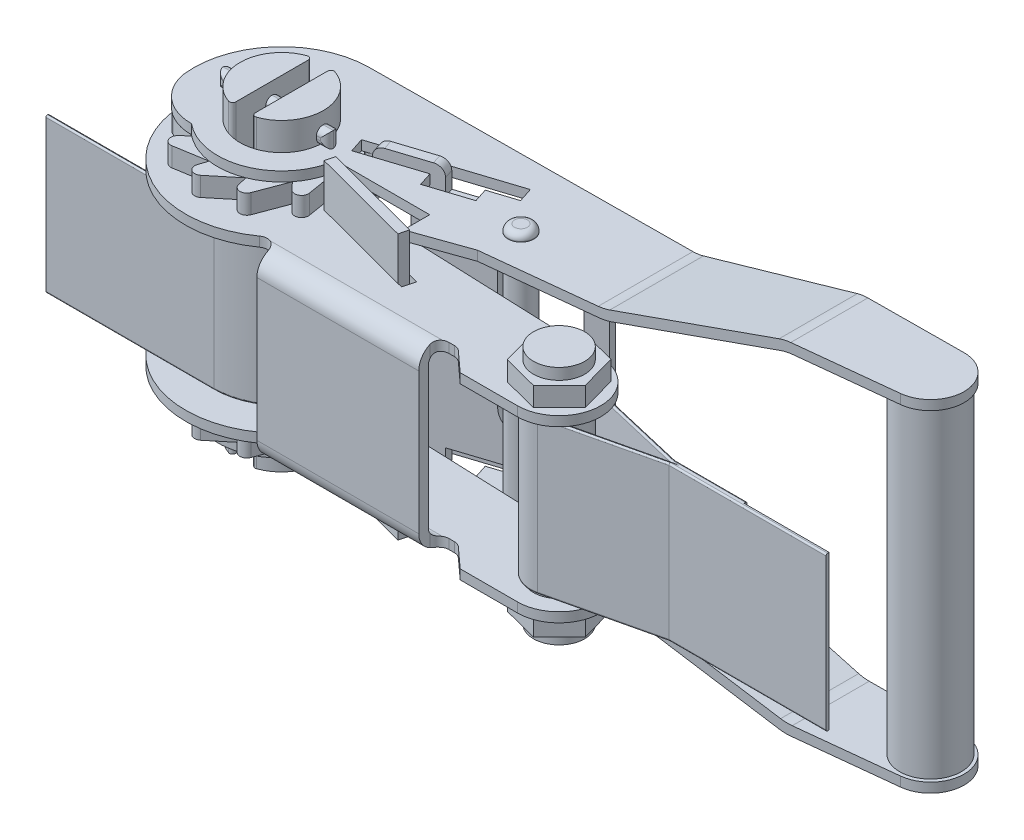
from build123d import *

# Parameters (mm, degrees)
SKETCH6_R                = 9.61135184745859
BOSS_EXTRUDE1_DEPTH      = 49.99999999999999
BOSS_EXTRUDE2_DEPTH      = 34.99999999999999
CUT_EXTRUDE2_START       = 35.801780174
CUT_EXTRUDE2_OUTLINE_W   = 224.768763946
CUT_EXTRUDE2_OUTLINE_H   = 70
CUT_EXTRUDE2_OUTLINE_R   = 3.996033937
CUT_EXTRUDE2_OUTLINE_R_2 = 13
CUT_EXTRUDE2_DEPTH       = 17.3864652
SKETCH9_W                = 147.82614241764912
SKETCH9_H                = 3
BOSS_EXTRUDE3_DEPTH      = 34.99999999999999
SKETCH10_R               = 13.000000000000002
CUT_EXTRUDE3_DEPTH       = 69.99999999999999
FILLET3_R                = 12
FILLET1_R                = 3
FILLET2_R                = 1
SKETCH11_R               = 13.000000000000002
BOSS_EXTRUDE4_DEPTH      = 6
SKETCH12_R               = 7.999999999999998
BOSS_EXTRUDE5_DEPTH      = 37.5
BOSS_EXTRUDE6_DEPTH      = 6
BOSS_EXTRUDE7_DEPTH      = 47.5
BOSS_EXTRUDE7_2_DEPTH    = 47.5
FILLET4_R                = 1
FILLET5_R                = 1
BOSS_EXTRUDE8_REACH      = 167.685
SKETCH15_W               = 50.51678297357947
SKETCH15_H               = 3
FILLET6_R                = 3
FILLET7_R                = 6
BOSS_EXTRUDE9_DEPTH      = 3
FILLET8_R                = 6
FILLET9_R                = 3
SKETCH17_R               = 4.234641109572187
BOSS_EXTRUDE10_DEPTH     = 3
SKETCH18_W               = 34.37557361080151
SKETCH18_H               = 4.853710087710901
BOSS_EXTRUDE11_DEPTH     = 2
BOSS_EXTRUDE11_2_DEPTH   = 2
FILLET10_R               = 2
FILLET11_R               = 2
SKETCH19_R               = 3.9960339372358598
BOSS_EXTRUDE12_DEPTH     = 41
FILLET12_R               = 2
SKETCH21_R               = 13.000000000000002
BOSS_EXTRUDE13_DEPTH     = 24
BOSS_EXTRUDE13_2_DEPTH   = 24
FILLET14_R               = 0.5
FILLET15_R               = 0.5


# Read off the part's stored shape, not the designer's step: Cut-Extrude2
with BuildPart() as part:
    # Sketch6 → Boss-Extrude1 (new, symmetric)
    with BuildSketch(Plane(origin=(0, 0, 0), x_dir=(1, 0, 0), z_dir=(0, 1, 0))):
        with Locations(Location((132.09279218975152, 21.208873885123804, 0), (0, 0, 90))):
            Circle(SKETCH6_R)
    extrude(amount=BOSS_EXTRUDE1_DEPTH, both=True)


with BuildPart() as body_2:
    # Sketch7 → Boss-Extrude2 (new, symmetric)
    with BuildSketch(Plane.XY):
        Polygon((143.76876394629363, 50.188245373729615), (101.02636733752342, 50.188245373729615), (50.15249039830427, 35.80178017370452), (-81.00000000000001, 35.80178017370453), (-81.00000000000001, 38.80178017370452), (49.73646730393172, 38.80178017370452), (100.61034424315088, 53.18824537372962), (143.76876394629363, 53.18824537372962), align=None)
    extrude(amount=BOSS_EXTRUDE2_DEPTH, both=True)

    # Cut-Extrude2 outline → Cut-Extrude2 (cut)
    # profile 1 of 4: a face of its own
    with BuildSketch(Plane(origin=(0, 0, 0), x_dir=(1, 0, 0), z_dir=(0, 1, 0)).offset(CUT_EXTRUDE2_START)):
        with Locations((31.384381973000004, 0)):
            Rectangle(CUT_EXTRUDE2_OUTLINE_W, CUT_EXTRUDE2_OUTLINE_H)
        with BuildLine():
            ThreePointArc((-64.763616752, -12.535987568), (-74.249472979, -9.196039153), (-79.304490688, -0.502160862))
            ThreePointArc((-79.304490688, -0.502160862), (-72.682079099, 21.010495289), (-52.211895915, 30.371174236))
            Line((-52.211895915, 30.371174236), (132.016568511, 31.708597212))
            ThreePointArc((132.016568511, 31.708597212), (142.575396332, 21.813034785), (133.223361355, 10.769917359))
            Line((133.223361355, 10.769917359), (14.061394225, -2.13566812))
            Line((14.061394225, -2.13566812), (-2.964752104, -8.175195839))
            Line((-2.964752104, -8.175195839), (-2.964752104, 0))
            Line((-2.964752104, 0), (-32.219531559, 0))
            ThreePointArc((-32.219531559, 0), (-44.823174053, -15.791354016), (-64.763616752, -12.535987568))
        make_face(mode=Mode.SUBTRACT)
    # profile 2 of 4: a face of its own
    with BuildSketch(Plane(origin=(0, 0, 0), x_dir=(1, 0, 0), z_dir=(0, 1, 0)).offset(CUT_EXTRUDE2_START)):
        with Locations((15.881169485, 9.634125828)):
            Circle(CUT_EXTRUDE2_OUTLINE_R)
    # profile 3 of 4: a face of its own
    with BuildSketch(Plane(origin=(0, 0, 0), x_dir=(1, 0, 0), z_dir=(0, 1, 0)).offset(CUT_EXTRUDE2_START)):
        Polygon((7.40122384, 17.995674749), (5.943232843, 22.505928047), (-18.509037252, 14.60145189), (-19.1190468, 16.488498916), (-24.25388904, 14.828602396), (-23.643879492, 12.941555369), (-33.875317839, 9.634125828), (-32.417326842, 5.12387253), (-13.966042498, 11.088461363), (-12.57730845, 6.79245245), (0.449412623, 11.003489123), (-0.939321424, 15.299498037), align=None)
    # profile 4 of 4: a face of its own
    with BuildSketch(Plane(origin=(0, 0, 0), x_dir=(1, 0, 0), z_dir=(0, 1, 0)).offset(CUT_EXTRUDE2_START)):
        with Locations((-52.012262471, 2.871898855)):
            Circle(CUT_EXTRUDE2_OUTLINE_R_2)
    extrude(amount=CUT_EXTRUDE2_DEPTH, mode=Mode.SUBTRACT)

    # Fillet3
    fillet3_edges = [body_2.edges().sort_by_distance(p)[0] for p in [
        (101.02636733752342, 50.188245373729615, -19.383255461272107),
        (50.15249039830427, 35.80178017370452, -16.443699774766543),
        (49.73646730393172, 38.80178017370452, -16.419661444559445),
        (100.61034424315088, 53.18824537372962, -19.35921713106501),
    ]]
    fillet(fillet3_edges, radius=FILLET3_R)

    # Sketch11 → Boss-Extrude4 (add)
    with BuildSketch(Plane.XZ.offset(-35.80178017370452)):
        with BuildLine():
            Line((-66.59428790947788, 14.864612404070485), (-64.37990306780027, 12.844963745801456))
            Line((-64.37990306780027, 12.844963745801456), (-73.80426310057402, 9.303634331822696))
            ThreePointArc((-73.80426310057402, 9.303634331822696), (-75.19028777978409, 7.1401863065424775), (-73.5089225687676, 5.1973577508918))
            Line((-73.5089225687676, 5.1973577508918), (-70.58138471298513, 4.555483126950324))
            Line((-70.58138471298513, 4.555483126950324), (-76.97245520878865, -3.2235781251114166))
            ThreePointArc((-76.97245520878865, -3.2235781251114166), (-77.0910637786166, -5.790191414376377), (-74.6635445150116, -6.632047693259443))
            Line((-74.6635445150116, -6.632047693259443), (-71.80728504939263, -5.724158495745956))
            Line((-71.80728504939263, -5.724158495745956), (-73.45258383010481, -15.656558405528473))
            ThreePointArc((-73.45258383010481, -15.656558405528473), (-72.27199522004992, -17.938615000636666), (-69.74877373015035, -17.45392429268236))
            Line((-69.74877373015035, -17.45392429268236), (-67.72912507188127, -15.239539451004536))
            Line((-67.72912507188127, -15.239539451004536), (-64.18779565790233, -24.663899483778728))
            ThreePointArc((-64.18779565790233, -24.663899483778728), (-62.02434763262211, -26.049924162988795), (-60.081519076971425, -24.368558951972304))
            Line((-60.081519076971425, -24.368558951972304), (-59.439644453030084, -21.441021096189534))
            Line((-59.439644453030084, -21.441021096189534), (-51.660583200968226, -27.832091591993304))
            ThreePointArc((-51.660583200968226, -27.832091591993304), (-49.093969911703255, -27.950700161821285), (-48.252113632820176, -25.523180898216285))
            Line((-48.252113632820176, -25.523180898216285), (-49.16000283033389, -22.66692143259692))
            Line((-49.16000283033389, -22.66692143259692), (-39.227602920551135, -24.312220213309445))
            ThreePointArc((-39.227602920551135, -24.312220213309445), (-36.94554632544294, -23.131631603254526), (-37.43023703339726, -20.608410113354964))
            Line((-37.43023703339726, -20.608410113354964), (-39.6446218750753, -18.588761455085557))
            Line((-39.6446218750753, -18.588761455085557), (-30.220261842300935, -15.04743204110692))
            ThreePointArc((-30.220261842300935, -15.04743204110692), (-28.834237163090872, -12.883984015826698), (-30.515602374107374, -10.94115546017602))
            Line((-30.515602374107374, -10.94115546017602), (-33.44314022989038, -10.29928083623445))
            Line((-33.44314022989038, -10.29928083623445), (-27.05206973408641, -2.5202195841728185))
            ThreePointArc((-27.05206973408641, -2.5202195841728185), (-26.933461164258436, 0.04639370509216212), (-29.36098042786345, 0.8882499839752214))
            Line((-29.36098042786345, 0.8882499839752214), (-32.21723989348291, -0.01963921353818541))
            Line((-32.21723989348291, -0.01963921353818541), (-30.57194111277031, 9.912760696244248))
            ThreePointArc((-30.57194111277031, 9.912760696244248), (-31.75252972282524, 12.194817291352448), (-34.275751212724806, 11.71012658339811))
            Line((-34.275751212724806, 11.71012658339811), (-36.295399870994274, 9.495741741720401))
            Line((-36.295399870994274, 9.495741741720401), (-39.83672928497287, 18.920101774494434))
            ThreePointArc((-39.83672928497287, 18.920101774494434), (-42.00017731025309, 20.306126453704486), (-43.94300586590377, 18.624761242687985))
            Line((-43.94300586590377, 18.624761242687985), (-44.584880489845375, 15.697223386905316))
            Line((-44.584880489845375, 15.697223386905316), (-52.36394174190699, 22.08829388270892))
            ThreePointArc((-52.36394174190699, 22.08829388270892), (-54.930555031171956, 22.20690245253688), (-55.772411310055034, 19.77938318893188))
            Line((-55.772411310055034, 19.77938318893188), (-54.86452211254154, 16.923123723312774))
            Line((-54.86452211254154, 16.923123723312774), (-64.79692202232404, 18.56842250402498))
            ThreePointArc((-64.79692202232404, 18.56842250402498), (-67.07897861743223, 17.387833893970043), (-66.59428790947788, 14.864612404070485))
        make_face()
        with Locations(Location((-52.01226247143909, -2.8718988546432773, 0), (0, 0, 90))):
            Circle(SKETCH11_R, mode=Mode.SUBTRACT)
    extrude(amount=BOSS_EXTRUDE4_DEPTH)


with BuildPart() as body_3:
    # Sketch9 → Boss-Extrude3 (new, symmetric)
    with BuildSketch(Plane.XY):
        with Locations((-9.374115610495167, -26.500000000000004)):
            Rectangle(SKETCH9_W, SKETCH9_H)
    extrude(amount=BOSS_EXTRUDE3_DEPTH, both=True)

    # Sketch10 → Cut-Extrude3 (cut)
    # profile 1 of 3: a face of its own
    with BuildSketch(Plane(origin=(0, 0, 0), x_dir=(1, 0, 0), z_dir=(0, 1, 0))):
        Polygon((73.92143290269355, 40.40180807210002), (-93.71216160194659, 40.40180807210002), (-93.71216160194659, -39.2449992671693), (73.92143290269355, -39.244999267169305), align=None)
        with BuildLine():
            ThreePointArc((51.53895559832939, -1.128101145356709), (64.5389555983294, -14.128101145356707), (51.538955598329395, -27.12810114535671))
            Line((51.538955598329395, -27.12810114535671), (33.6755600799571, -27.12810114535671))
            Line((33.6755600799571, -27.12810114535671), (26.592047389567554, -20.688544154093456))
            Line((26.592047389567554, -20.688544154093456), (20.754061511296502, -20.688544154093456))
            Line((20.754061511296502, -20.688544154093456), (20.754061511296502, -27.128101145356716))
            Line((20.754061511296502, -27.128101145356716), (-29.762721462282965, -27.12810114535672))
            Line((-29.76272146228297, -27.12810114535672), (-29.76272146228299, -17.25166755098872))
            ThreePointArc((-29.76272146228299, -17.25166755098872), (-62.69784673295965, -25.160551787245737), (-82.01154808516429, 2.6648658472755336))
            Line((-82.01154808516429, 2.6648658472755336), (-76.01136948261474, 2.6648658472755336))
            ThreePointArc((-76.01136948261474, 2.6648658472755375), (-51.65248535511648, 26.869202045347244), (-28.030148137420955, 1.9455122884182452))
            Line((-28.03014813742095, 1.9455122884182454), (51.538955598329395, -1.1281011453567105))
        make_face(mode=Mode.SUBTRACT)
    # profile 2 of 3: a face of its own
    with BuildSketch(Plane(origin=(0, 0, 0), x_dir=(1, 0, 0), z_dir=(0, 1, 0))):
        with Locations(Location((-52.01226247143909, 2.8718988546432773, 0), (0, 0, 270))):
            Circle(SKETCH10_R)
    # profile 3 of 3: a face of its own
    with BuildSketch(Plane(origin=(0, 0, 0), x_dir=(1, 0, 0), z_dir=(0, 1, 0))):
        Polygon((-29.762721462282986, -0.9197060989426281), (2.3462008682077995, -9.413724255451257), (1.3636084156105066, -13.128101145356707), (-30.745313914880278, -4.6340829888480775), align=None)
    extrude(amount=-CUT_EXTRUDE3_DEPTH, mode=Mode.SUBTRACT)

    # Fillet1
    fillet1_edges = [body_3.edges().sort_by_distance(p)[0] for p in [
        (-29.76272146228299, -26.5, 17.25166755098872),
        (20.754061511296502, -26.5, 20.688544154093456),
        (26.592047389567554, -26.5, 20.688544154093456),
    ]]
    fillet(fillet1_edges, radius=FILLET1_R)

    # Fillet2
    fillet2_edges = [body_3.edges().sort_by_distance(p)[0] for p in [
        (-76.01136948261474, -26.5, -2.6648658472755358),
        (-82.01154808516429, -26.5, -2.6648658472755313),
    ]]
    fillet(fillet2_edges, radius=FILLET2_R)


with BuildPart() as body_4:
    # Mirror1: mirrored copy
    add(body_2.part.mirror(Plane.ZX))


with BuildPart() as body_5:
    # Mirror1 2: mirrored copy
    add(body_3.part.mirror(Plane.ZX))


with BuildPart() as body_3_1:
    add(body_3.part)

    add(body_5.part)  # Boss-Extrude5 merges body 5
    # Sketch12 → Boss-Extrude5 (add, symmetric)
    with BuildSketch(Plane(origin=(0, 0, 0), x_dir=(1, 0, 0), z_dir=(0, 1, 0))):
        with Locations(Location((51.538955598329395, -14.12810114535671, 0), (0, 0, 90))):
            Circle(SKETCH12_R)
    extrude(amount=BOSS_EXTRUDE5_DEPTH, both=True)

    # Sketch13 → Boss-Extrude6 (add)
    with BuildSketch(Plane(origin=(0, 28, 0), x_dir=(1, 0, 0), z_dir=(0, 1, 0))):
        Polygon((48.48449443308388, -3.106680129414185), (40.46689443009672, -11.262631601361084), (43.52135559534224, -22.284052617303598), (54.5934167635749, -25.149522161299224), (62.61101676656207, -16.99357068935233), (59.55655560131656, -5.972149673409814), align=None)
    boss_extrude6 = extrude(amount=BOSS_EXTRUDE6_DEPTH)

    # Mirror2: Boss-Extrude6 across plane
    add(boss_extrude6.mirror(Plane.ZX))

    # Sketch15 → Boss-Extrude8 (add, up to next)
    with BuildSketch(Plane(origin=(0, -25, 0), x_dir=(1, 0, 0), z_dir=(0, 1, 0)), mode=Mode.PRIVATE) as boss_extrude8_sk1:
        with Locations((-4.504329975493233, -25.62810114535672)):
            Rectangle(SKETCH15_W, SKETCH15_H)
    boss_extrude8_tool1 = extrude(boss_extrude8_sk1.sketch, amount=BOSS_EXTRUDE8_REACH, mode=Mode.PRIVATE) - body_3_1.part
    add(boss_extrude8_tool1.solids().sort_by_distance((-4.50433, -25, 25.628101))[0])

    # Fillet6
    fillet6_edges = [body_3_1.edges().sort_by_distance(p)[0] for p in [
        (-4.504329975493228, 25, 24.12810114535672),
        (-4.504329975493231, -25, 24.12810114535672),
    ]]
    fillet(fillet6_edges, radius=FILLET6_R)

    # Fillet7
    fillet7_edges = [body_3_1.edges().sort_by_distance(p)[0] for p in [
        (-4.504329975493228, -28, 27.12810114535672),
        (-4.504329975493228, 28, 27.12810114535672),
    ]]
    fillet(fillet7_edges, radius=FILLET7_R)


with BuildPart() as body_5_2:
    # Sketch14 → Boss-Extrude7 (new, symmetric)
    with BuildSketch(Plane(origin=(0, 0, 0), x_dir=(1, 0, 0), z_dir=(0, 1, 0))):
        with BuildLine():
            Line((-49.01226247143909, -9.777211786030241), (-49.01226247143909, 15.521009495316797))
            ThreePointArc((-49.01226247143909, 15.521009495316797), (-39.01226247143909, 2.8718988546432773), (-49.01226247143909, -9.777211786030241))
        make_face()
    extrude(amount=BOSS_EXTRUDE7_DEPTH, both=True)

    # Fillet5
    fillet5_edges = [body_5_2.edges().sort_by_distance(p)[0] for p in [
        (-49.01226247143909, 0, 9.77721178603024),
        (-49.01226247143909, 0, -15.521009495316797),
    ]]
    fillet(fillet5_edges, radius=FILLET5_R)


with BuildPart() as body_6:
    # Sketch14 → Boss-Extrude7 2 (new, symmetric)
    with BuildSketch(Plane(origin=(0, 0, 0), x_dir=(1, 0, 0), z_dir=(0, 1, 0))):
        with BuildLine():
            Line((-55.01226247143908, -9.777211786030241), (-55.01226247143908, 15.521009495316797))
            ThreePointArc((-55.01226247143908, 15.521009495316797), (-65.01226247143909, 2.871898854643279), (-55.01226247143908, -9.777211786030241))
        make_face()
    extrude(amount=BOSS_EXTRUDE7_2_DEPTH, both=True)

    # Fillet4
    fillet4_edges = [body_6.edges().sort_by_distance(p)[0] for p in [
        (-55.01226247143908, 0, -15.521009495316797),
        (-55.01226247143909, 0, 9.777211786030241),
    ]]
    fillet(fillet4_edges, radius=FILLET4_R)


with BuildPart() as body_2_1:
    add(body_2.part)

    add(body_4.part)  # Boss-Extrude9 merges body 4
    # Sketch16 → Boss-Extrude9 (add)
    with BuildSketch(Plane(origin=(-4.566685668778086, 0, -14.12691103072603), x_dir=(-0.9515191663224783, 0, 0.3075894603541801), z_dir=(-0.3075894603541801, 0, -0.9515191663224783))):
        Polygon((-34.55706427424359, -34), (-34.557064274243615, 34), (6.008093453893082, 34.00000000000001), (6.008093453893082, 42.06447314697748), (24.126726852992906, 42.06447314697748), (24.126726852992906, 28.68561573451147), (14.600824968169945, 28.68561573451147), (14.600824968169938, -28.68561573451147), (24.126726852992892, -28.68561573451147), (24.126726852992892, -42.06447314697748), (6.008093453893078, -42.06447314697748), (6.008093453893078, -34.00000000000001), align=None)
        Polygon((-28.245714526718736, -25), (-28.24571452671875, 25), (-6.89948800561524, 25), (-6.899488005615236, -25), align=None, mode=Mode.SUBTRACT)
    extrude(amount=BOSS_EXTRUDE9_DEPTH)

    # Fillet8
    fillet8_edges = [body_2_1.edges().sort_by_distance(p)[0] for p in [
        (21.848268879336786, 25, -24.242273868801394),
        (21.84826887933677, -25, -24.24227386880139),
        (1.5369252158455926, -25, -17.676399572577076),
        (1.5369252158455953, 25, -17.67639957257708),
    ]]
    fillet(fillet8_edges, radius=FILLET8_R)

    # Fillet9
    fillet9_edges = [body_2_1.edges().sort_by_distance(p)[0] for p in [
        (-10.744885933745241, 42.06447314697748, -13.706163556969292),
        (27.853639129471233, 34, -26.183578531749056),
        (27.853639129471205, -34, -26.18357853174905),
        (-10.744885933745238, -42.06447314697748, -13.706163556969292),
        (-27.985112880559303, -42.06447314697748, -8.133062887384957),
        (-27.985112880559317, 42.06447314697748, -8.133062887384954),
    ]]
    fillet(fillet9_edges, radius=FILLET9_R)

    add(body_3_1.part)  # Boss-Extrude10 merges body 3
    # Sketch17 → Boss-Extrude10 (add)
    with BuildSketch(Plane(origin=(-3.1565549955040177, 0, 11.932347837624759), x_dir=(-0.9667454532933696, 0, -0.25574054926154643), z_dir=(0.25574054926154643, 0, -0.9667454532933696))):
        Polygon((-3.0935020470364996, 41.38228603912517), (29.31416953340523, 41.382286039125184), (29.314169533405234, 19.628750869488858), (33.13642588321386, 19.628750869488858), (33.13642588321386, -19.39856964860974), (29.314169533405238, -19.39856964860974), (29.31416953340524, -41.38228603912517), (-3.093502047036489, -41.38228603912517), align=None)
        with Locations(Location((22.602441811747376, 0, 0), (0, 0, 180))):
            Circle(SKETCH17_R, mode=Mode.SUBTRACT)
    extrude(amount=BOSS_EXTRUDE10_DEPTH)

    # Sketch19 → Boss-Extrude12 (add, symmetric)
    with BuildSketch(Plane(origin=(0, 0, 0), x_dir=(1, 0, 0), z_dir=(0, 1, 0))):
        with Locations(Location((15.88116948462022, 9.634125827732062, 0), (0, 0, 270))):
            Circle(SKETCH19_R)
    extrude(amount=BOSS_EXTRUDE12_DEPTH, both=True)

    # Fillet12
    fillet12_edges = [body_2_1.edges().sort_by_distance(p)[0] for p in [
        (15.881169484620221, -41, -13.630159764967921),
        (15.881169484620221, 41, -13.630159764967921),
    ]]
    fillet(fillet12_edges, radius=FILLET12_R)


with BuildPart() as body_5_3:
    # Sketch18 → Boss-Extrude11 (new, symmetric)
    with BuildSketch(Plane.XY.offset(-2.8718988546432773)):
        with Locations((-53.10567349259029, 41.22863521755997)):
            Rectangle(SKETCH18_W, SKETCH18_H)
    extrude(amount=BOSS_EXTRUDE11_DEPTH, both=True)

    # Fillet10
    fillet10_edges = [body_5_3.edges().sort_by_distance(p)[0] for p in [
        (-53.10567349259029, 43.65549026141542, -0.8718988546432773),
        (-35.91788668718954, 41.22863521755997, -0.8718988546432773),
        (-53.10567349259029, 38.80178017370452, -0.8718988546432773),
        (-70.29346029799105, 41.22863521755997, -0.8718988546432773),
        (-53.10567349259029, 38.80178017370452, -4.871898854643277),
        (-35.91788668718954, 41.22863521755997, -4.871898854643277),
        (-53.10567349259029, 43.65549026141542, -4.871898854643277),
        (-70.29346029799105, 41.22863521755997, -4.871898854643277),
    ]]
    fillet(fillet10_edges, radius=FILLET10_R - 0.0001)  # a hair under: the kernel refuses the full size


with BuildPart() as body_6_2:
    # Sketch18 → Boss-Extrude11 2 (new, symmetric)
    with BuildSketch(Plane.XY.offset(-2.8718988546432773)):
        with Locations((-53.10567349259029, -41.22863521755997)):
            Rectangle(SKETCH18_W, SKETCH18_H)
    extrude(amount=BOSS_EXTRUDE11_2_DEPTH, both=True)

    # Fillet11
    fillet11_edges = [body_6_2.edges().sort_by_distance(p)[0] for p in [
        (-35.91788668718954, -41.22863521755997, -4.871898854643277),
        (-53.10567349259029, -43.65549026141542, -4.871898854643277),
        (-70.29346029799105, -41.22863521755997, -4.871898854643277),
        (-53.10567349259029, -38.80178017370452, -4.871898854643277),
        (-70.29346029799105, -41.22863521755997, -0.8718988546432773),
        (-70.29346029799105, -43.65549026141542, -2.871898854643277),
        (-70.29346029799105, -38.80178017370452, -2.871898854643277),
    ]]
    fillet(fillet11_edges, radius=FILLET11_R - 0.0001)  # a hair under: the kernel refuses the full size


with BuildPart() as body_7:
    # Sketch21 → Boss-Extrude13 (new, symmetric)
    with BuildSketch(Plane(origin=(0, 0, 0), x_dir=(1, 0, 0), z_dir=(0, 1, 0))):
        with BuildLine():
            Line((-52.01226247143909, -18.259735714897403), (-104.43196098733875, -18.259735714897403))
            Line((-104.43196098733875, -18.259735714897403), (-104.43196098733875, -17.25973571489741))
            Line((-104.43196098733875, -17.25973571489741), (-58.43591167878855, -17.259735714897403))
            ThreePointArc((-58.43591167878855, -17.259735714897403), (-48.76175216000023, 23.752036840198745), (-52.01226247143909, -18.259735714897403))
        make_face()
        with Locations(Location((-52.01226247143909, 2.8718988546432773, 0), (0, 0, 270))):
            Circle(SKETCH21_R, mode=Mode.SUBTRACT)
    extrude(amount=BOSS_EXTRUDE13_DEPTH, both=True)

    # Fillet14
    fillet14_edges = [body_7.edges().sort_by_distance(p)[0] for p in [
        (-81.43393633306366, 24, 17.259735714897406),
    ]]
    fillet(fillet14_edges, radius=FILLET14_R)
    fillet14_2_edges = [body_7.edges().sort_by_distance(p)[0] for p in [
        (-81.43393633306366, -24, 17.259735714897406),
    ]]
    fillet(fillet14_2_edges, radius=FILLET14_R)
    fillet14_3_edges = [body_7.edges().sort_by_distance(p)[0] for p in [
        (-78.22211172938893, -24, 18.259735714897403),
        (-48.76175216000019, -24, -23.75203684019874),
    ]]
    fillet(fillet14_3_edges, radius=FILLET14_R - 0.0001)  # a hair under: the kernel refuses the full size
    fillet14_4_edges = [body_7.edges().sort_by_distance(p)[0] for p in [
        (-78.22211172938893, 24, 18.259735714897403),
        (-48.76175216000019, 24, -23.75203684019874),
    ]]
    fillet(fillet14_4_edges, radius=FILLET14_R - 0.0001)  # a hair under: the kernel refuses the full size


with BuildPart() as body_8:
    # Sketch21 → Boss-Extrude13 2 (new, symmetric)
    with BuildSketch(Plane(origin=(0, 0, 0), x_dir=(1, 0, 0), z_dir=(0, 1, 0))):
        with BuildLine():
            Line((53.59133363255555, -5.366576495587619), (86.83750511218271, -13.15445757730109))
            Line((86.83750511218271, -13.15445757730109), (109.25548034296129, -13.15445757730109))
            Line((109.25548034296129, -13.15445757730109), (109.25548034296129, -14.12810114535671))
            Line((109.25548034296129, -14.12810114535671), (135.79762522877192, -14.12810114535671))
            Line((135.79762522877192, -14.12810114535671), (135.79762522877192, -15.10174471341233))
            Line((135.79762522877192, -15.10174471341233), (86.83750511218271, -15.10174471341233))
            Line((86.83750511218271, -15.10174471341233), (53.59133363255555, -22.889625795125802))
            ThreePointArc((53.59133363255555, -22.889625795125802), (42.54025737114756, -14.128101145356709), (53.59133363255555, -5.366576495587619))
        make_face()
        with BuildLine():
            Line((53.36325863966084, -6.340220063643238), (86.609430119288, -14.12810114535671))
            Line((86.609430119288, -14.12810114535671), (53.36325863966084, -21.91598222707018))
            ThreePointArc((53.36325863966084, -21.91598222707018), (43.54025737114756, -14.128101145356709), (53.36325863966084, -6.340220063643238))
        make_face(mode=Mode.SUBTRACT)
    extrude(amount=BOSS_EXTRUDE13_2_DEPTH, both=True)

    # Fillet15
    fillet15_edges = [body_8.edges().sort_by_distance(p)[0] for p in [
        (98.046492727572, 24, 13.15445757730109),
        (70.21441937236914, 24, 9.260517036444355),
        (42.540257371147554, 24, 14.128101145356714),
        (70.21441937236914, 24, 18.995685254269066),
        (43.54025737114756, -24, 14.128101145356709),
        (69.98634437947442, -24, 18.022041686213445),
        (69.98634437947442, -24, 10.234160604499975),
        (43.54025737114756, 24, 14.128101145356709),
        (69.98634437947442, 24, 18.022041686213445),
        (69.98634437947442, 24, 10.234160604499975),
        (111.31756517047731, 24, 15.10174471341233),
        (111.31756517047731, -24, 15.10174471341233),
        (70.21441937236914, -24, 18.995685254269066),
        (42.540257371147554, -24, 14.128101145356714),
        (70.21441937236914, -24, 9.260517036444355),
        (98.046492727572, -24, 13.15445757730109),
    ]]
    fillet(fillet15_edges, radius=FILLET15_R - 0.0001)  # a hair under: the kernel refuses the full size


solid = Compound([part.part, body_5_2.part, body_6.part, body_2_1.part, body_5_3.part, body_6_2.part, body_7.part, body_8.part])
